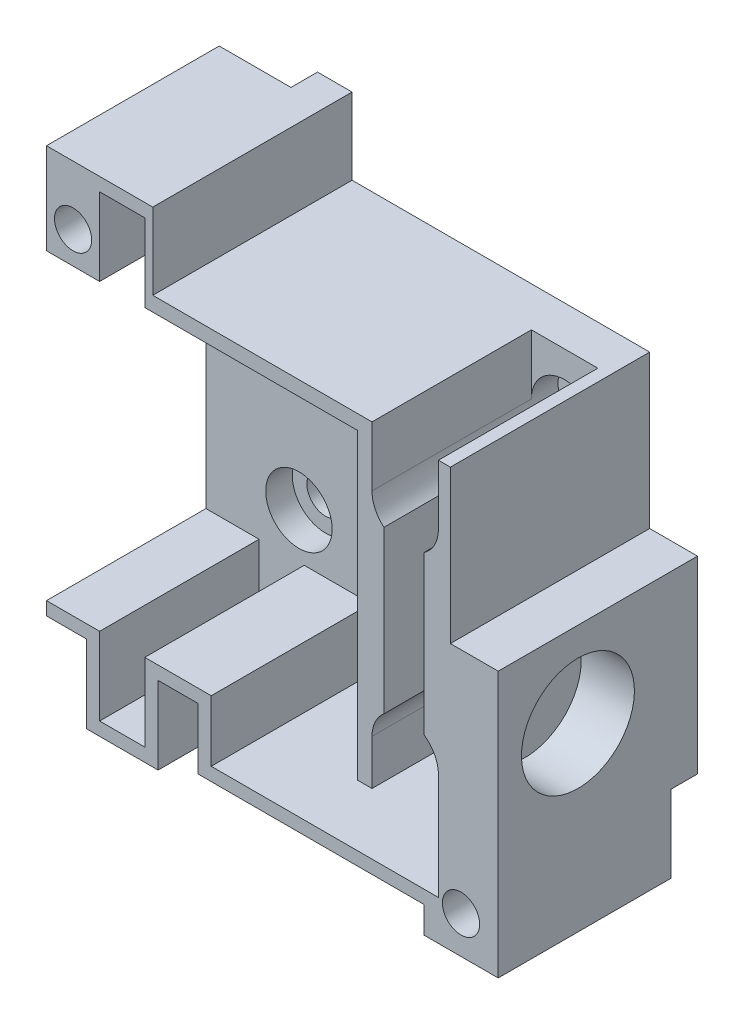
from build123d import *

# Parameters (mm, degrees)
SKETCH1_W                = 34
SKETCH1_H                = 38
BOSS_EXTRUDE1_DEPTH      = 16
SKETCH2_W                = 22.4
SKETCH2_H                = 22.8
SKETCH2_W_2              = 2.4
SKETCH2_H_2              = 4.85
CUT_EXTRUDE1_DEPTH       = 13
CUT_EXTRUDE2_DEPTH       = 13
SKETCH4_R                = 1.4
CUT_EXTRUDE3_DEPTH       = 31.099833887
CUT_EXTRUDE5_START       = -2
SKETCH5_R                = 1.4
CUT_EXTRUDE5_DEPTH       = 2
SKETCH7_W                = 34
SKETCH7_H                = 1
CUT_EXTRUDE6_DEPTH       = 45.598206242
CUT_EXTRUDE9_DEPTH       = 30.580398915
CUT_EXTRUDE10_DEPTH      = 29.178005607
CUT_EXTRUDE10_DEPTH_BACK = 2
SKETCH10_R               = 2.5
SKETCH11_W               = 5
SKETCH11_H               = 4.5
CUT_EXTRUDE11_DEPTH      = 12
SKETCH12_W               = 1
SKETCH12_H               = 4.85
SKETCH12_H_2             = 22.8
CUT_EXTRUDE12_DEPTH      = 12
SKETCH14_R               = 4.25
CUT_EXTRUDE13_DEPTH      = 4
SKETCH17_W               = 3.4
SKETCH17_H               = 1
CUT_EXTRUDE16_DEPTH      = 12
SKETCH18_R               = 1.4
CUT_EXTRUDE17_DEPTH      = 12


with BuildPart() as part:
    # Sketch1 → Boss-Extrude1 (new body)
    with BuildSketch(Plane.XY):
        Rectangle(SKETCH1_W, SKETCH1_H)
    extrude(amount=BOSS_EXTRUDE1_DEPTH)

    # Sketch2 → Cut-Extrude1 (cut)
    with BuildSketch(Plane.XY.offset(16)):
        with Locations((-5.8, 0)):
            Rectangle(SKETCH2_W, SKETCH2_H)
        with Locations((-11.8, -13.825)):
            Rectangle(SKETCH2_W_2, SKETCH2_H_2)
        with Locations((-11.8, 13.825)):
            Rectangle(SKETCH2_W_2, SKETCH2_H_2)
    extrude(amount=-CUT_EXTRUDE1_DEPTH, mode=Mode.SUBTRACT)

    # Sketch3 → Cut-Extrude2 (cut)
    with BuildSketch(Plane.XY.offset(16)):
        Polygon((-4.6, -16), (11.4, -16), (11.4, 19), (8.4, 19), (8.4, -11.4), (-4.6, -11.4), align=None)
    extrude(amount=-CUT_EXTRUDE2_DEPTH, mode=Mode.SUBTRACT)

    # Sketch4 → Cut-Extrude3 (cut, through all)
    with BuildSketch(Plane.XY.offset(16)):
        with Locations((-15, 13.8)):
            Circle(SKETCH4_R)
        with Locations((14.2, -16.2)):
            Circle(SKETCH4_R)
    extrude(amount=-CUT_EXTRUDE3_DEPTH, mode=Mode.SUBTRACT)

    # Sketch5 → Cut-Extrude5 (cut)
    # profile 1 of 2: a face of its own
    with BuildSketch(Plane(origin=(0, 0, 0), x_dir=(-1, 0, 0), z_dir=(0, 0, -1)).offset(CUT_EXTRUDE5_START)):
        with BuildLine():
            Line((18.4, 13.8), (18.4, 19))
            Line((18.4, 19), (11.6, 19))
            Line((11.6, 19), (11.6, 13.8))
            ThreePointArc((11.6, 13.8), (15, 10.4), (18.4, 13.8))
        make_face()
        with Locations((15, 13.8)):
            Circle(SKETCH5_R, mode=Mode.SUBTRACT)
    # profile 2 of 2: a face of its own
    with BuildSketch(Plane(origin=(0, 0, 0), x_dir=(-1, 0, 0), z_dir=(0, 0, -1)).offset(CUT_EXTRUDE5_START)):
        with BuildLine():
            Line((-13.122967039, -19), (-10.2, -19))
            Line((-10.2, -19), (-10.2, -13.2))
            Line((-10.2, -13.2), (-17, -13.2))
            Line((-17, -13.2), (-17, -15.122967039))
            ThreePointArc((-17, -15.122967039), (-17.2, -16.2), (-17, -17.277032961))
            Line((-17, -17.277032961), (-17, -19.2))
            Line((-17, -19.2), (-14.2, -19.2))
            ThreePointArc((-14.2, -19.2), (-13.652277442, -19.149576241), (-13.122967039, -19))
        make_face()
        with Locations((-14.2, -16.2)):
            Circle(SKETCH5_R, mode=Mode.SUBTRACT)
    extrude(amount=CUT_EXTRUDE5_DEPTH, mode=Mode.SUBTRACT)

    # Sketch7 → Cut-Extrude6 (cut, through all)
    with BuildSketch(Plane(origin=(0, 19, 0), x_dir=(1, 0, 0), z_dir=(0, 1, 0))):
        with Locations((0, -15.5)):
            Rectangle(SKETCH7_W, SKETCH7_H)
    extrude(amount=-CUT_EXTRUDE6_DEPTH, mode=Mode.SUBTRACT)

    # Sketch9 → Cut-Extrude9 (cut, through all)
    with BuildSketch(Plane.XY.offset(15)):
        Polygon((-17, 19), (-17, 18.25), (-9, 18.25), (-9, 12.5), (13.4, 12.5), (13.4, 1), (17, 1), (17, 19), align=None)
        Polygon((-14, -12.4), (-17, -12.4), (-17, -19), (11.4, -19), (11.4, -17), (-5.6, -17), (-5.6, -12.4), (-8.6, -12.4), (-8.6, -18.25), (-14, -18.25), align=None)
    extrude(amount=-CUT_EXTRUDE9_DEPTH, mode=Mode.SUBTRACT)

    # Sketch10 → Cut-Extrude10 (cut, two sides: drawn at the far end of the back side and taken through both)
    with BuildSketch(Plane.XY.offset(3).offset(-CUT_EXTRUDE10_DEPTH_BACK)):
        with Locations((-10, 8)):
            Circle(SKETCH10_R)
        with Locations((10, 8)):
            Circle(SKETCH10_R)
        with Locations((-10, -8)):
            Circle(SKETCH10_R)
        with Locations((10, -8)):
            Circle(SKETCH10_R)
    extrude(amount=CUT_EXTRUDE10_DEPTH + CUT_EXTRUDE10_DEPTH_BACK, mode=Mode.SUBTRACT)

    # Sketch11 → Cut-Extrude11 (cut)
    with BuildSketch(Plane.XY.offset(15)):
        Polygon((12.5, -8), (7.5, -8), (7.5, -11.4), (11.4, -11.4), (11.4, -16), (12.5, -16), (12.5, -11.4), align=None)
        with Locations((10, 10.25)):
            Rectangle(SKETCH11_W, SKETCH11_H)
    extrude(amount=-CUT_EXTRUDE11_DEPTH, mode=Mode.SUBTRACT)

    # Sketch12 → Cut-Extrude12 (cut)
    with BuildSketch(Plane.XY.offset(15)):
        with Locations((-10.1, 13.825)):
            Rectangle(SKETCH12_W, SKETCH12_H)
        with Locations((-10.1, -13.825)):
            Rectangle(SKETCH12_W, SKETCH12_H)
        with Locations((5.9, 0)):
            Rectangle(SKETCH12_W, SKETCH12_H_2)
    extrude(amount=-CUT_EXTRUDE12_DEPTH, mode=Mode.SUBTRACT)

    # Sketch14 → Cut-Extrude13 (cut)
    with BuildSketch(Plane(origin=(17, 0, 0), x_dir=(0, 0, -1), z_dir=(1, 0, 0))):
        with Locations((-9, -5.4)):
            Circle(SKETCH14_R)
    extrude(amount=-CUT_EXTRUDE13_DEPTH, mode=Mode.SUBTRACT)

    # Sketch17 → Cut-Extrude16 (cut)
    with BuildSketch(Plane.XY.offset(15)):
        with Locations((-11.3, 16.75)):
            Rectangle(SKETCH17_W, SKETCH17_H)
        with Locations((-11.3, -16.75)):
            Rectangle(SKETCH17_W, SKETCH17_H)
    extrude(amount=-CUT_EXTRUDE16_DEPTH, mode=Mode.SUBTRACT)

    # Sketch18 → Cut-Extrude17 (cut)
    with BuildSketch(Plane.XY.offset(1)):
        with Locations((-10, 8)):
            Circle(SKETCH18_R)
        with Locations((10, 8)):
            Circle(SKETCH18_R)
        with Locations((-10, -8)):
            Circle(SKETCH18_R)
        with Locations((10, -8)):
            Circle(SKETCH18_R)
    extrude(amount=-CUT_EXTRUDE17_DEPTH, mode=Mode.SUBTRACT)


solid = part.part
